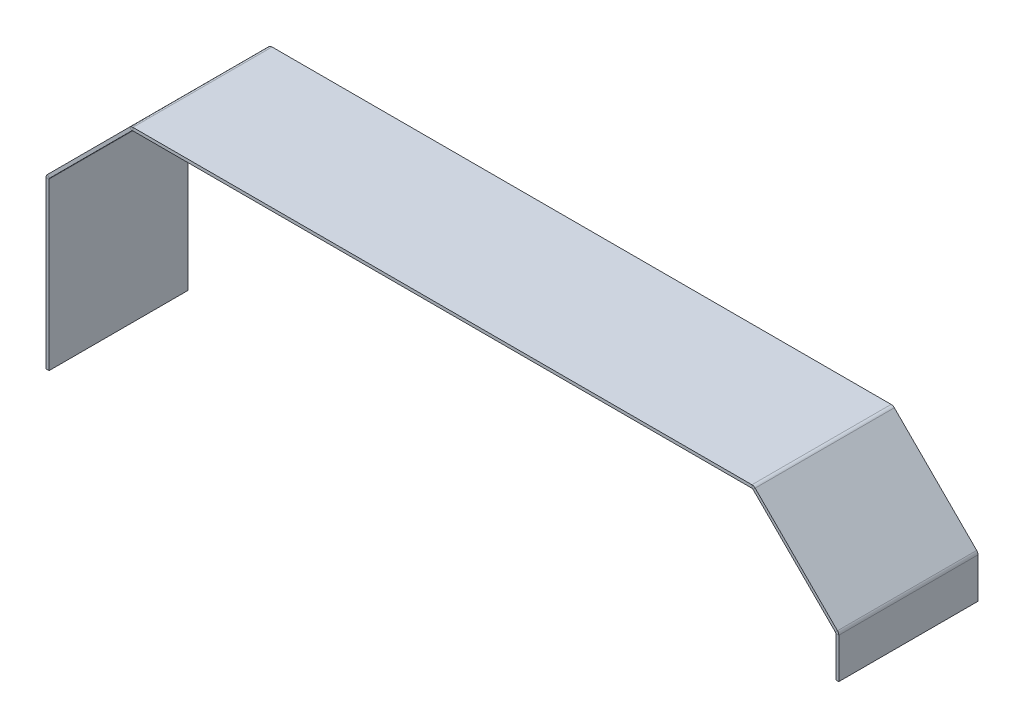
from build123d import *

# Parameters (mm, degrees)
EXTRU_MINCE1_DEPTH        = 92
CONVERTIR_VOLUME1_DEPTH   = 92
CONVERTIR_VOLUME1_2_DEPTH = 92


# Read off the part's stored shape, not the designer's step: Convertir-Volume1
with BuildPart() as part:
    # Esquisse1 → Extru.-Mince1 (new body)
    with BuildSketch(Plane.XY):
        Polygon((520, -82), (520, -55), (465, 0), (55, 0), (0, -55), (0, -165), (10, -165), (10, -59.142135624), (59.142135624, -10), (460.857864376, -10), (510, -59.142135624), (510, -82), align=None)
    extrude(amount=EXTRU_MINCE1_DEPTH)

    # Convertir-Volume1 outline → Convertir-Volume1 (cut)
    with BuildSketch(Plane.XY):
        with BuildLine():
            Line((0, -55.414213562), (0, -165))
            Line((0, -165), (10, -165))
            Line((10, -165), (10, -59.142135624))
            Line((10, -59.142135624), (59.142135624, -10))
            Line((59.142135624, -10), (460.857864376, -10))
            Line((460.857864376, -10), (510, -59.142135624))
            Line((510, -59.142135624), (510, -82))
            Line((510, -82), (520, -82))
            Line((520, -82), (520, -55.414213562))
            ThreePointArc((520, -55.414213562), (519.923879533, -55.03153013), (519.707106781, -54.707106781))
            Line((519.707106781, -54.707106781), (465.292893219, -0.292893219))
            ThreePointArc((465.292893219, -0.292893219), (464.96846987, -0.076120467), (464.585786438, 0))
            Line((464.585786438, 0), (55.414213562, 0))
            ThreePointArc((55.414213562, 0), (55.03153013, -0.076120467), (54.707106781, -0.292893219))
            Line((54.707106781, -0.292893219), (0.292893219, -54.707106781))
            ThreePointArc((0.292893219, -54.707106781), (0.076120467, -55.03153013), (0, -55.414213562))
        make_face()
    extrude(amount=CONVERTIR_VOLUME1_DEPTH, mode=Mode.SUBTRACT)

    # Convertir-Volume1 2 outline → Convertir-Volume1 2 (add)
    with BuildSketch(Plane.XY):
        with BuildLine():
            Line((-2, -55.414213562), (-2, -165))
            Line((-2, -165), (0, -165))
            Line((0, -165), (0, -55))
            Line((0, -55), (55, 0))
            Line((55, 0), (465, 0))
            Line((465, 0), (520, -55))
            Line((520, -55), (520, -82))
            Line((520, -82), (522, -82))
            Line((522, -82), (522, -55.414213562))
            ThreePointArc((522, -55.414213562), (521.771638598, -54.266163265), (521.121320344, -53.292893219))
            Line((521.121320344, -53.292893219), (466.707106781, 1.121320344))
            ThreePointArc((466.707106781, 1.121320344), (465.733836735, 1.771638598), (464.585786438, 2))
            Line((464.585786438, 2), (55.414213562, 2))
            ThreePointArc((55.414213562, 2), (54.266163265, 1.771638598), (53.292893219, 1.121320344))
            Line((53.292893219, 1.121320344), (-1.121320344, -53.292893219))
            ThreePointArc((-1.121320344, -53.292893219), (-1.771638598, -54.266163265), (-2, -55.414213562))
        make_face()
    extrude(amount=CONVERTIR_VOLUME1_2_DEPTH)


solid = part.part
